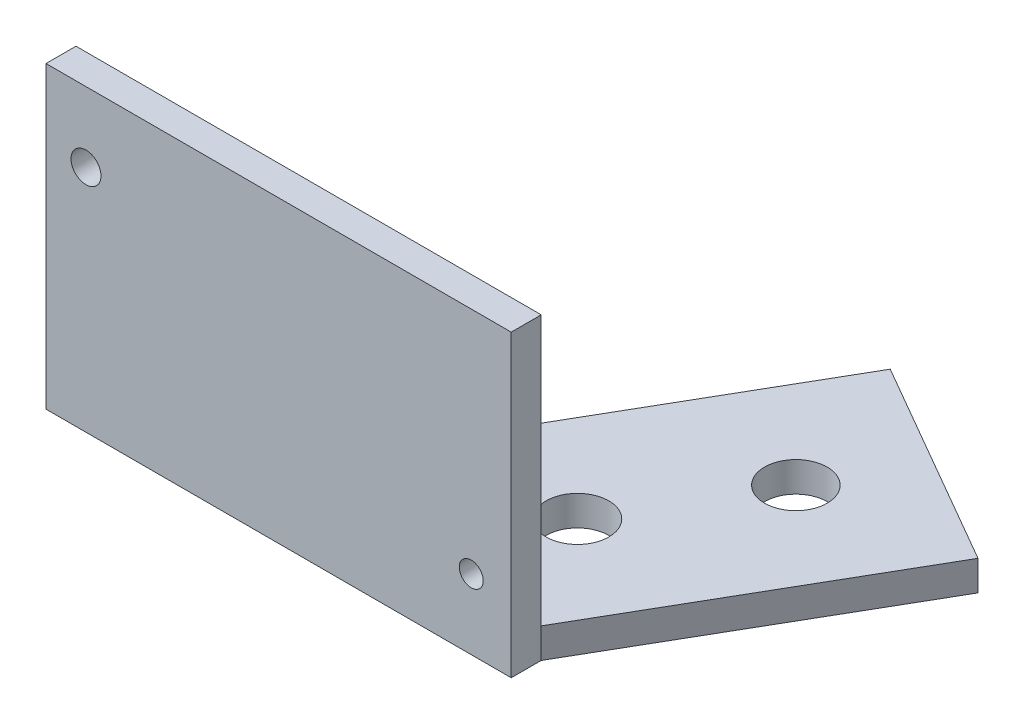
from build123d import *

# Parameters (mm, degrees)
SKETCH1_W           = 36.957
SKETCH1_H           = 21.3995
SKETCH1_R           = 1.190625
SKETCH1_R_2         = 0.9525
BOSS_EXTRUDE1_DEPTH = 2.38125
BOSS_EXTRUDE3_DEPTH = 2.38125
CUT_EXTRUDE2_REACH  = 63.337
SKETCH4_R           = 2.4892


with BuildPart() as part:
    # Sketch1 → Boss-Extrude1 (new body)
    with BuildSketch(Plane.XY):
        with Locations((16.891, 9.11225)):
            Rectangle(SKETCH1_W, SKETCH1_H)
        with Locations((1.5875, 14.25575)):
            Circle(SKETCH1_R, mode=Mode.SUBTRACT)
        with Locations((32.1945, 1.5875)):
            Circle(SKETCH1_R_2, mode=Mode.SUBTRACT)
    extrude(amount=BOSS_EXTRUDE1_DEPTH)

    # Sketch2 → Boss-Extrude3 (add)
    with BuildSketch(Plane.XZ.offset(1.5875)):
        Polygon((-1.5875, 2.38125), (35.3695, 2.38125), (35.3695, 0), (48.0695, -21.997045256), (31.571716058, -31.522045256), (13.372454744, 0), (-1.5875, 0), align=None)
    extrude(amount=BOSS_EXTRUDE3_DEPTH)

    # Sketch4 → Cut-Extrude2 (cut, up to next)
    with BuildSketch(Plane(origin=(0, -1.5875, 0), x_dir=(1, 0, 0), z_dir=(0, 1, 0)), mode=Mode.PRIVATE) as cut_extrude2_sk1:
        with Locations((35.800977372, 19.797340731)):
            Circle(SKETCH4_R)
    cut_extrude2_tool1 = extrude(cut_extrude2_sk1.sketch, amount=-CUT_EXTRUDE2_REACH, mode=Mode.PRIVATE) & part.part
    # Sketch4 → Cut-Extrude2 (cut, up to next)
    with BuildSketch(Plane(origin=(0, -1.5875, 0), x_dir=(1, 0, 0), z_dir=(0, 1, 0)), mode=Mode.PRIVATE) as cut_extrude2_sk2:
        with Locations((29.450977372, 8.798818102)):
            Circle(SKETCH4_R)
    cut_extrude2_tool2 = extrude(cut_extrude2_sk2.sketch, amount=-CUT_EXTRUDE2_REACH, mode=Mode.PRIVATE) & part.part
    add(cut_extrude2_tool1.solids().sort_by_distance((35.800977, -1.5875, -19.797341))[0], mode=Mode.SUBTRACT)
    add(cut_extrude2_tool2.solids().sort_by_distance((29.450977, -1.5875, -8.798818))[0], mode=Mode.SUBTRACT)


solid = part.part
